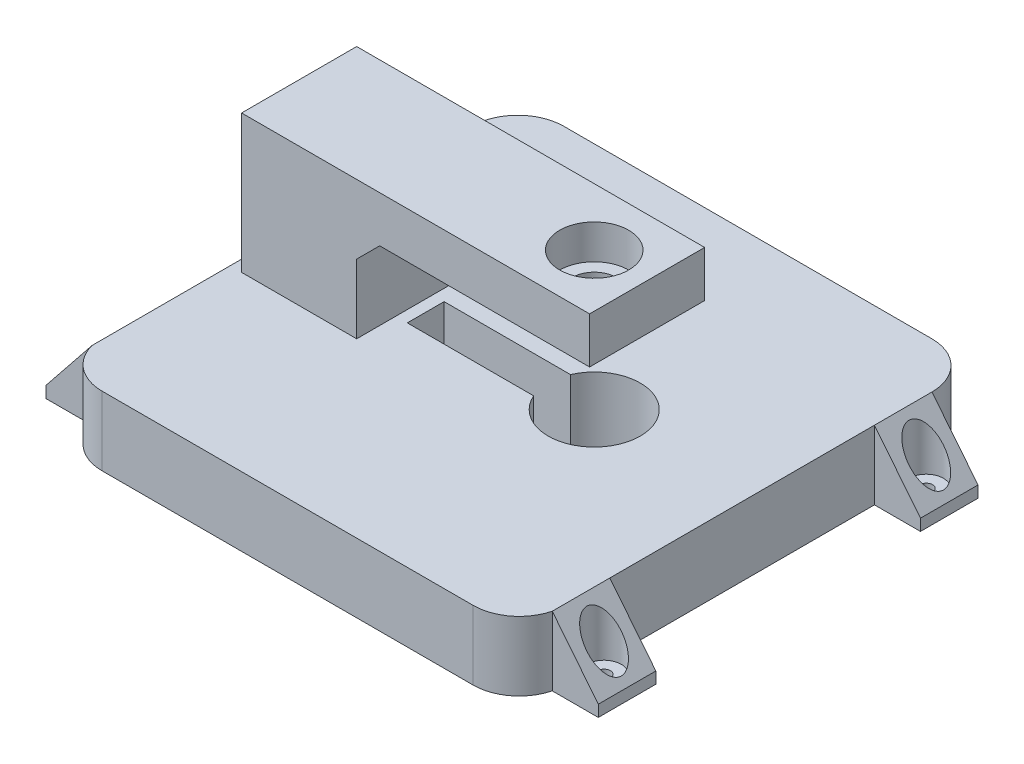
from build123d import *

# Parameters (mm, degrees)
SZKIC1_W                        = 200
SZKIC1_H                        = 200
DODANIE_WYCI_GNI_CIE1_DEPTH     = 30
WYTNIJ_WYCI_GNI_CIE1_DEPTH      = 145.568322948
WYTNIJ_WYCI_GNI_CIE1_DEPTH_BACK = 145.568322948
SZKIC2_W                        = 80
SZKIC2_H                        = 16
WYTNIJ_WYCI_GNI_CIE2_DEPTH      = 145.568322948
WYTNIJ_WYCI_GNI_CIE2_DEPTH_BACK = 145.568322948
SZKIC3_R                        = 20
SZKIC4_W                        = 28
SZKIC4_H                        = 16
DODANIE_WYCI_GNI_CIE2_DEPTH     = 9
DODANIE_WYCI_GNI_CIE3_START     = 30
SZKIC5_W                        = 50
SZKIC5_H                        = 50
DODANIE_WYCI_GNI_CIE3_DEPTH     = 40
DODANIE_WYCI_GNI_CIE4_START     = 70
SZKIC6_W                        = 151.215135745
SZKIC6_H                        = 50
SZKIC6_R                        = 9.5
DODANIE_WYCI_GNI_CIE4_DEPTH     = 5
DODANIE_WYCI_GNI_CIE5_START     = 75
SZKIC7_W                        = 151.215135745
SZKIC7_H                        = 50
SZKIC7_R                        = 15
DODANIE_WYCI_GNI_CIE5_DEPTH     = 15
DODANIE_WYCI_GNI_CIE6_START     = 60
DODANIE_WYCI_GNI_CIE6_DEPTH     = 25
WYTNIJ_WYCI_GNI_CIE3_DEPTH      = 181.277563773
WYTNIJ_WYCI_GNI_CIE4_START      = 5
WYTNIJ_WYCI_GNI_CIE4_DEPTH      = 176.277563773
SZYK_LINIOWY1_OUTLINE_R         = 7.5
SZYK_LINIOWY1_OUTLINE_R_2       = 2.75
SZYK_LINIOWY1_DEPTH             = 5
SZYK_LINIOWY1_2_OUTLINE_W       = 20
SZYK_LINIOWY1_2_OUTLINE_H       = 25
SZYK_LINIOWY1_2_OUTLINE_R       = 7.5
SZYK_LINIOWY1_2_DEPTH           = 30
SZYK_START                      = -113
SZYK_LINIOWY1_3_OUTLINE_W       = 35
SZYK_LINIOWY1_3_OUTLINE_H       = 25
SZYK_LINIOWY1_3_DEPTH           = 16.172267629
ZAOKR_GLENIE1_R                 = 20
SFAZOWANIE1_SIZE                = 10
SZKIC10_R                       = 2.6
WYTNIJ_WYCI_GNI_CIE5_DEPTH      = 176.957381204
WYTNIJ_WYCI_GNI_CIE6_DEPTH      = 181.277563773
WYTNIJ_WYCI_GNI_CIE6_DEPTH_BACK = 5
SZKIC11_R                       = 6


with BuildPart() as part:
    # Szkic1 → Dodanie-wyciągnięcie1 (new body)
    with BuildSketch(Plane(origin=(0, 0, 0), x_dir=(1, 0, 0), z_dir=(0, 1, 0))):
        Rectangle(SZKIC1_W, SZKIC1_H)
    extrude(amount=DODANIE_WYCI_GNI_CIE1_DEPTH)

    # Szkic2 → Wytnij-wyciągnięcie1 (cut, two sides: drawn at the far end of the back side and taken through both)
    with BuildSketch(Plane(origin=(0, 0, 0), x_dir=(1, 0, 0), z_dir=(0, 1, 0)).offset(-WYTNIJ_WYCI_GNI_CIE1_DEPTH_BACK)):
        Rectangle(SZKIC2_W, SZKIC2_H)
    extrude(amount=WYTNIJ_WYCI_GNI_CIE1_DEPTH + WYTNIJ_WYCI_GNI_CIE1_DEPTH_BACK, mode=Mode.SUBTRACT)

    # Szkic3 → Wytnij-wyciągnięcie2 (cut, two sides: drawn at the far end of the back side and taken through both)
    with BuildSketch(Plane(origin=(0, 0, 0), x_dir=(1, 0, 0), z_dir=(0, 1, 0)).offset(-WYTNIJ_WYCI_GNI_CIE2_DEPTH_BACK)):
        with Locations((33.228865647, 0)):
            Circle(SZKIC3_R)
    extrude(amount=WYTNIJ_WYCI_GNI_CIE2_DEPTH + WYTNIJ_WYCI_GNI_CIE2_DEPTH_BACK, mode=Mode.SUBTRACT)

    # Szkic4 → Dodanie-wyciągnięcie2 (add)
    with BuildSketch(Plane(origin=(0, 0, 0), x_dir=(1, 0, 0), z_dir=(0, 1, 0))):
        with Locations((-26, 0)):
            Rectangle(SZKIC4_W, SZKIC4_H)
    extrude(amount=DODANIE_WYCI_GNI_CIE2_DEPTH)

    # Szkic5 → Dodanie-wyciągnięcie3 (add)
    with BuildSketch(Plane(origin=(0, 0, 0), x_dir=(1, 0, 0), z_dir=(0, 1, 0)).offset(DODANIE_WYCI_GNI_CIE3_START)):
        with Locations((-70, 0)):
            Rectangle(SZKIC5_W, SZKIC5_H)
    extrude(amount=DODANIE_WYCI_GNI_CIE3_DEPTH)

    # Szkic6 → Dodanie-wyciągnięcie4 (add)
    with BuildSketch(Plane(origin=(0, 0, 0), x_dir=(1, 0, 0), z_dir=(0, 1, 0)).offset(DODANIE_WYCI_GNI_CIE4_START)):
        with Locations((-19.392432127, 0)):
            Rectangle(SZKIC6_W, SZKIC6_H)
        with Locations(Location((33.228865647, 0, 0), (0, 0, 90))):
            Circle(SZKIC6_R, mode=Mode.SUBTRACT)
    extrude(amount=DODANIE_WYCI_GNI_CIE4_DEPTH)

    # Szkic7 → Dodanie-wyciągnięcie5 (add)
    with BuildSketch(Plane(origin=(0, 0, 0), x_dir=(1, 0, 0), z_dir=(0, 1, 0)).offset(DODANIE_WYCI_GNI_CIE5_START)):
        with Locations((-19.392432127, 0)):
            Rectangle(SZKIC7_W, SZKIC7_H)
        with Locations(Location((33.228865647, 0, 0), (0, 0, 270))):
            Circle(SZKIC7_R, mode=Mode.SUBTRACT)
    extrude(amount=DODANIE_WYCI_GNI_CIE5_DEPTH)

    # Szkic8 → Dodanie-wyciągnięcie6 (add)
    with BuildSketch(Plane.XY.offset(DODANIE_WYCI_GNI_CIE6_START)):
        Polygon((-100, 0), (-120, 0), (-120, 5), (-100, 30), align=None)
    dodanie_wyci_gni_cie6 = extrude(amount=DODANIE_WYCI_GNI_CIE6_DEPTH)

    # Szkic9 → Wytnij-wyciągnięcie3 (cut, symmetric)
    with BuildSketch(Plane(origin=(0, 0, 0), x_dir=(1, 0, 0), z_dir=(0, 1, 0))):
        with BuildLine():
            ThreePointArc((-107.25, -72.5), (-107.5214161, -71.308730991), (-108.282088619, -70.352610774))
            Line((-108.282088619, -70.352610774), (-111.717911381, -74.647389226))
            ThreePointArc((-111.717911381, -74.647389226), (-108.808730991, -74.9785839), (-107.25, -72.5))
        make_face()
        with BuildLine():
            Line((-111.717911381, -74.647389226), (-108.282088619, -70.352610774))
            ThreePointArc((-108.282088619, -70.352610774), (-112.147389226, -70.782088619), (-111.717911381, -74.647389226))
        make_face()
    wytnij_wyci_gni_cie3 = extrude(amount=WYTNIJ_WYCI_GNI_CIE3_DEPTH, both=True, mode=Mode.SUBTRACT)

    # Szkic9<3> → Wytnij-wyciągnięcie4 (cut, through all)
    with BuildSketch(Plane(origin=(0, 0, 0), x_dir=(1, 0, 0), z_dir=(0, 1, 0)).offset(WYTNIJ_WYCI_GNI_CIE4_START)):
        with BuildLine():
            ThreePointArc((-102.5, -72.5), (-103.240225728, -69.251084521), (-105.314787143, -66.643483929))
            Line((-105.314787143, -66.643483929), (-108.282088619, -70.352610774))
            ThreePointArc((-108.282088619, -70.352610774), (-107.5214161, -71.308730991), (-107.25, -72.5))
            ThreePointArc((-107.25, -72.5), (-108.808730991, -74.9785839), (-111.717911381, -74.647389226))
            Line((-111.717911381, -74.647389226), (-114.685212857, -78.356516071))
            ThreePointArc((-114.685212857, -78.356516071), (-106.751084521, -79.259774272), (-102.5, -72.5))
        make_face()
        with BuildLine():
            Line((-108.282088619, -70.352610774), (-105.314787143, -66.643483929))
            ThreePointArc((-105.314787143, -66.643483929), (-115.856516071, -67.814787143), (-114.685212857, -78.356516071))
            Line((-114.685212857, -78.356516071), (-111.717911381, -74.647389226))
            ThreePointArc((-111.717911381, -74.647389226), (-112.147389226, -70.782088619), (-108.282088619, -70.352610774))
        make_face()
    wytnij_wyci_gni_cie4 = extrude(amount=WYTNIJ_WYCI_GNI_CIE4_DEPTH, mode=Mode.SUBTRACT)



with BuildPart() as body_2:
    # Szyk liniowy1: read off the stored shape, not the designer's step
    # Szyk liniowy1 outline → Szyk liniowy1 (new body)
    with BuildSketch(Plane(origin=(0, 0, 0), x_dir=(1, 0, 0), z_dir=(0, 1, 0))):
        with Locations((-110, 67.5)):
            Circle(SZYK_LINIOWY1_OUTLINE_R)
        with Locations((-110, 67.5)):
            Circle(SZYK_LINIOWY1_OUTLINE_R_2, mode=Mode.SUBTRACT)
    szyk_liniowy1 = extrude(amount=SZYK_LINIOWY1_DEPTH)


with BuildPart() as part_1:
    add(part.part)

    add(body_2.part)  # Szyk liniowy1 2 merges body 2
    # Szyk liniowy1 2 outline → Szyk liniowy1 2 (add)
    with BuildSketch(Plane(origin=(0, 0, 0), x_dir=(1, 0, 0), z_dir=(0, 1, 0))):
        with Locations((-110, 67.5)):
            Rectangle(SZYK_LINIOWY1_2_OUTLINE_W, SZYK_LINIOWY1_2_OUTLINE_H)
        with Locations((-110, 67.5)):
            Circle(SZYK_LINIOWY1_2_OUTLINE_R, mode=Mode.SUBTRACT)
    szyk_liniowy1_2 = extrude(amount=SZYK_LINIOWY1_2_DEPTH)

    # Szyk liniowy1 3 outline → Szyk liniowy1 3 (cut)
    with BuildSketch(Plane(origin=(0, 0, 0), x_dir=(0.6246950475544242, 0.7808688094430304, 0), z_dir=(0.7808688094430304, -0.6246950475544242, 0)).offset(SZYK_START)):
        with Locations((-55.5, -67.5)):
            Rectangle(SZYK_LINIOWY1_3_OUTLINE_W, SZYK_LINIOWY1_3_OUTLINE_H)
    szyk_liniowy1_3 = extrude(amount=SZYK_LINIOWY1_3_DEPTH, mode=Mode.SUBTRACT)

    # Lustro1: Dodanie-wyciągnięcie6, Wytnij-wyciągnięcie3, Wytnij-wyciągnięcie4, Szyk liniowy1, Szyk liniowy1 2, Szyk liniowy1 3 across plane
    add(dodanie_wyci_gni_cie6.mirror(Plane(origin=(0, 0, 0), x_dir=(0, 0, 1), z_dir=(1, 0, 0))))
    add(wytnij_wyci_gni_cie3.mirror(Plane(origin=(0, 0, 0), x_dir=(0, 0, 1), z_dir=(1, 0, 0))), mode=Mode.SUBTRACT)
    add(wytnij_wyci_gni_cie4.mirror(Plane(origin=(0, 0, 0), x_dir=(0, 0, 1), z_dir=(1, 0, 0))), mode=Mode.SUBTRACT)
    add(szyk_liniowy1.mirror(Plane(origin=(0, 0, 0), x_dir=(0, 0, 1), z_dir=(1, 0, 0))))
    add(szyk_liniowy1_2.mirror(Plane(origin=(0, 0, 0), x_dir=(0, 0, 1), z_dir=(1, 0, 0))))
    add(szyk_liniowy1_3.mirror(Plane(origin=(0, 0, 0), x_dir=(0, 0, 1), z_dir=(1, 0, 0))), mode=Mode.SUBTRACT)

    # Zaokrąglenie1
    # the kernel refuses this fillet: 20 mm, written as the material it takes off along each edge
    with BuildSketch(Plane(origin=(-100, -48.412291828, 100), x_dir=(1, 0, 0), z_dir=(0, 1, 0))) as zaokr_glenie1_piece_1:
        with BuildLine():
            CenterArc((19.364916731, 20), ZAOKR_GLENIE1_R, 194.477512186, 75.522487814)
            Line((0, 15), (-0.387298335, 14.9))
            ThreePointArc((-0.387298335, 14.9), (-0.4, 7.5), (-0.4, 0))
            Line((-0.4, 0), (0, -0.4))
            Line((0, -0.4), (19.364916731, -0.4))
            Line((19.364916731, -0.4), (19.364916731, 0))
        make_face()
    extrude(amount=126.824583655, mode=Mode.SUBTRACT)
    with BuildSketch(Plane(origin=(-100, -50, -100), x_dir=(0, 0, 1), z_dir=(0, 1, 0)), Plane(origin=(100, -50, -100), x_dir=(-1, 0, 0), z_dir=(0, 1, 0))) as zaokr_glenie1_piece_2:
        with BuildLine():
            CenterArc((ZAOKR_GLENIE1_R, ZAOKR_GLENIE1_R), ZAOKR_GLENIE1_R, 180, 90)
            Line((0, ZAOKR_GLENIE1_R), (-ZAOKR_GLENIE1_R * 0.02, ZAOKR_GLENIE1_R))
            Line((-ZAOKR_GLENIE1_R * 0.02, ZAOKR_GLENIE1_R), (-ZAOKR_GLENIE1_R * 0.02, -ZAOKR_GLENIE1_R * 0.02))
            Line((-ZAOKR_GLENIE1_R * 0.02, -ZAOKR_GLENIE1_R * 0.02), (ZAOKR_GLENIE1_R, -ZAOKR_GLENIE1_R * 0.02))
            Line((ZAOKR_GLENIE1_R, -ZAOKR_GLENIE1_R * 0.02), (ZAOKR_GLENIE1_R, 0))
        make_face()
    extrude(amount=130, mode=Mode.SUBTRACT)
    with BuildSketch(Plane(origin=(100, -48.412291828, 100), x_dir=(-1, 0, 0), z_dir=(0, 1, 0))) as zaokr_glenie1_piece_3:
        with BuildLine():
            CenterArc((19.364916731, -20), ZAOKR_GLENIE1_R, 90, 75.522487814)
            Line((0, -15), (-0.387298335, -14.9))
            ThreePointArc((-0.387298335, -14.9), (-0.4, -7.5), (-0.4, 0))
            Line((-0.4, 0), (0, 0.4))
            Line((0, 0.4), (19.364916731, 0.4))
            Line((19.364916731, 0.4), (19.364916731, 0))
        make_face()
    extrude(amount=126.824583655, mode=Mode.SUBTRACT)

    # Sfazowanie1
    sfazowanie1_edges = [part_1.edges().sort_by_distance(p)[0] for p in [
        (-45, 70, 0),
    ]]
    chamfer(sfazowanie1_edges, length=SFAZOWANIE1_SIZE)

    # Szkic10 → Wytnij-wyciągnięcie5 (cut, through all)
    with BuildSketch(Plane(origin=(0, 9, 0), x_dir=(1, 0, 0), z_dir=(0, 1, 0))):
        with Locations(Location((-35, 0, 0), (0, 0, 270))):
            Circle(SZKIC10_R)
        with Locations(Location((-20, 0, 0), (0, 0, 270))):
            Circle(SZKIC10_R)
    extrude(amount=-WYTNIJ_WYCI_GNI_CIE5_DEPTH, mode=Mode.SUBTRACT)

    # Szkic11 → Wytnij-wyciągnięcie6 (cut, two sides: drawn at the far end of the back side and taken through both)
    with BuildSketch(Plane(origin=(0, 0, 0), x_dir=(-1, 0, 0), z_dir=(0, -1, 0)).offset(-WYTNIJ_WYCI_GNI_CIE6_DEPTH_BACK)):
        with Locations(Location((20, 0, 0), (0, 0, 270))):
            Circle(SZKIC11_R)
        with Locations(Location((35, 0, 0), (0, 0, 270))):
            Circle(SZKIC11_R)
    extrude(amount=WYTNIJ_WYCI_GNI_CIE6_DEPTH + WYTNIJ_WYCI_GNI_CIE6_DEPTH_BACK, mode=Mode.SUBTRACT)


solid = part_1.part
